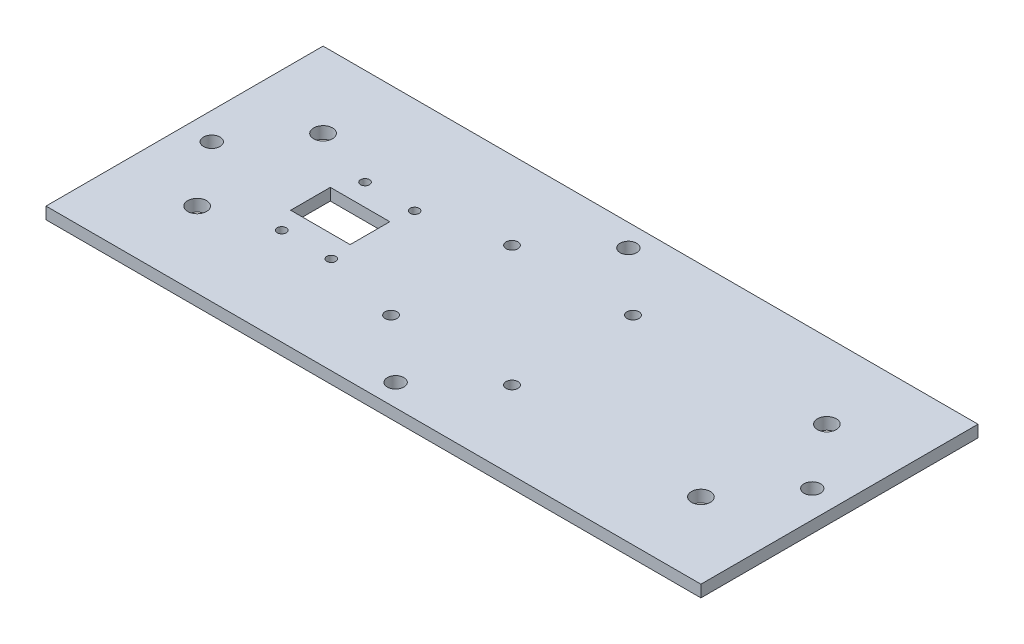
from build123d import *

# Parameters (mm, degrees)
SKETCH1_W           = 165.1
SKETCH1_H           = 69.85
BOSS_EXTRUDE1_DEPTH = 3
CUT_EXTRUDE1_REACH  = 91.684
SKETCH6_R           = 1.5
SKETCH6_W           = 15
SKETCH6_H           = 10
CUT_EXTRUDE3_REACH  = 91.684
SKETCH8_R           = 2.38125
SKETCH9_R           = 2.0828
CUT_EXTRUDE5_DEPTH  = 5.08
SKETCH10_R          = 2.0828
CUT_EXTRUDE6_DEPTH  = 5.08
SKETCH11_R          = 1.125
SKETCH11_R_2        = 1.125000036
CUT_EXTRUDE7_DEPTH  = 41.91


with BuildPart() as part:
    # Sketch1 → Boss-Extrude1 (new body)
    with BuildSketch(Plane(origin=(0, 0, 0), x_dir=(1, 0, 0), z_dir=(0, 1, 0))):
        Rectangle(SKETCH1_W, SKETCH1_H)
    extrude(amount=BOSS_EXTRUDE1_DEPTH)

    # Sketch6 → Cut-Extrude1 (cut, up to next)
    with BuildSketch(Plane.XZ, mode=Mode.PRIVATE) as cut_extrude1_sk1:
        with Locations((-15.25, 15.25)):
            Circle(SKETCH6_R)
    cut_extrude1_tool1 = extrude(cut_extrude1_sk1.sketch, amount=-CUT_EXTRUDE1_REACH, mode=Mode.PRIVATE) & part.part
    # Sketch6 → Cut-Extrude1 (cut, up to next)
    with BuildSketch(Plane.XZ, mode=Mode.PRIVATE) as cut_extrude1_sk2:
        with Locations((15.25, 15.25)):
            Circle(SKETCH6_R)
    cut_extrude1_tool2 = extrude(cut_extrude1_sk2.sketch, amount=-CUT_EXTRUDE1_REACH, mode=Mode.PRIVATE) & part.part
    # Sketch6 → Cut-Extrude1 (cut, up to next)
    with BuildSketch(Plane.XZ, mode=Mode.PRIVATE) as cut_extrude1_sk3:
        with Locations((-15.25, -15.25)):
            Circle(SKETCH6_R)
    cut_extrude1_tool3 = extrude(cut_extrude1_sk3.sketch, amount=-CUT_EXTRUDE1_REACH, mode=Mode.PRIVATE) & part.part
    # Sketch6 → Cut-Extrude1 (cut, up to next)
    with BuildSketch(Plane.XZ, mode=Mode.PRIVATE) as cut_extrude1_sk4:
        with Locations((15.25, -15.25)):
            Circle(SKETCH6_R)
    cut_extrude1_tool4 = extrude(cut_extrude1_sk4.sketch, amount=-CUT_EXTRUDE1_REACH, mode=Mode.PRIVATE) & part.part
    # Sketch6 → Cut-Extrude1 (cut, up to next)
    with BuildSketch(Plane.XZ, mode=Mode.PRIVATE) as cut_extrude1_sk5:
        with Locations((-43.3, 0)):
            Rectangle(SKETCH6_W, SKETCH6_H)
    cut_extrude1_tool5 = extrude(cut_extrude1_sk5.sketch, amount=-CUT_EXTRUDE1_REACH, mode=Mode.PRIVATE) & part.part
    add(cut_extrude1_tool1.solids().sort_by_distance((-15.25, 0, 15.25))[0], mode=Mode.SUBTRACT)
    add(cut_extrude1_tool2.solids().sort_by_distance((15.25, 0, 15.25))[0], mode=Mode.SUBTRACT)
    add(cut_extrude1_tool3.solids().sort_by_distance((-15.25, 0, -15.25))[0], mode=Mode.SUBTRACT)
    add(cut_extrude1_tool4.solids().sort_by_distance((15.25, 0, -15.25))[0], mode=Mode.SUBTRACT)
    add(cut_extrude1_tool5.solids().sort_by_distance((-43.3, 0, 0))[0], mode=Mode.SUBTRACT)

    # Sketch8 → Cut-Extrude3 (cut, up to next)
    with BuildSketch(Plane(origin=(0, 3, 0), x_dir=(1, 0, 0), z_dir=(0, 1, 0)), mode=Mode.PRIVATE) as cut_extrude3_sk1:
        with Locations((-63.5, -15.875)):
            Circle(SKETCH8_R)
    cut_extrude3_tool1 = extrude(cut_extrude3_sk1.sketch, amount=-CUT_EXTRUDE3_REACH, mode=Mode.PRIVATE) & part.part
    # Sketch8 → Cut-Extrude3 (cut, up to next)
    with BuildSketch(Plane(origin=(0, 3, 0), x_dir=(1, 0, 0), z_dir=(0, 1, 0)), mode=Mode.PRIVATE) as cut_extrude3_sk2:
        with Locations((-63.5, 15.875)):
            Circle(SKETCH8_R)
    cut_extrude3_tool2 = extrude(cut_extrude3_sk2.sketch, amount=-CUT_EXTRUDE3_REACH, mode=Mode.PRIVATE) & part.part
    # Sketch8 → Cut-Extrude3 (cut, up to next)
    with BuildSketch(Plane(origin=(0, 3, 0), x_dir=(1, 0, 0), z_dir=(0, 1, 0)), mode=Mode.PRIVATE) as cut_extrude3_sk3:
        with Locations((63.5, 15.875)):
            Circle(SKETCH8_R)
    cut_extrude3_tool3 = extrude(cut_extrude3_sk3.sketch, amount=-CUT_EXTRUDE3_REACH, mode=Mode.PRIVATE) & part.part
    # Sketch8 → Cut-Extrude3 (cut, up to next)
    with BuildSketch(Plane(origin=(0, 3, 0), x_dir=(1, 0, 0), z_dir=(0, 1, 0)), mode=Mode.PRIVATE) as cut_extrude3_sk4:
        with Locations((63.5, -15.875)):
            Circle(SKETCH8_R)
    cut_extrude3_tool4 = extrude(cut_extrude3_sk4.sketch, amount=-CUT_EXTRUDE3_REACH, mode=Mode.PRIVATE) & part.part
    add(cut_extrude3_tool1.solids().sort_by_distance((-63.5, 3, 15.875))[0], mode=Mode.SUBTRACT)
    add(cut_extrude3_tool2.solids().sort_by_distance((-63.5, 3, -15.875))[0], mode=Mode.SUBTRACT)
    add(cut_extrude3_tool3.solids().sort_by_distance((63.5, 3, -15.875))[0], mode=Mode.SUBTRACT)
    add(cut_extrude3_tool4.solids().sort_by_distance((63.5, 3, 15.875))[0], mode=Mode.SUBTRACT)

    # Sketch9 → Cut-Extrude5 (cut)
    with BuildSketch(Plane(origin=(0, 3, 0), x_dir=(1, 0, 0), z_dir=(0, 1, 0))):
        with Locations((-75.692, 0)):
            Circle(SKETCH9_R)
        with Locations((75.692, 0)):
            Circle(SKETCH9_R)
    extrude(amount=-CUT_EXTRUDE5_DEPTH, mode=Mode.SUBTRACT)

    # Sketch10 → Cut-Extrude6 (cut)
    with BuildSketch(Plane(origin=(0, 3, 0), x_dir=(1, 0, 0), z_dir=(0, 1, 0))):
        with Locations((0, -29.337)):
            Circle(SKETCH10_R)
        with Locations((0, 29.337)):
            Circle(SKETCH10_R)
    extrude(amount=-CUT_EXTRUDE6_DEPTH, mode=Mode.SUBTRACT)

    # Sketch11 → Cut-Extrude7 (cut)
    with BuildSketch(Plane(origin=(0, 3, 0), x_dir=(1, 0, 0), z_dir=(0, 1, 0))):
        with Locations((-47.55, 10.5)):
            Circle(SKETCH11_R)
        with Locations((-35.05, 10.5)):
            Circle(SKETCH11_R_2)
        with Locations((-35.05, -10.5)):
            Circle(SKETCH11_R_2)
        with Locations((-47.55, -10.5)):
            Circle(SKETCH11_R_2)
    extrude(amount=-CUT_EXTRUDE7_DEPTH, mode=Mode.SUBTRACT)


solid = part.part
